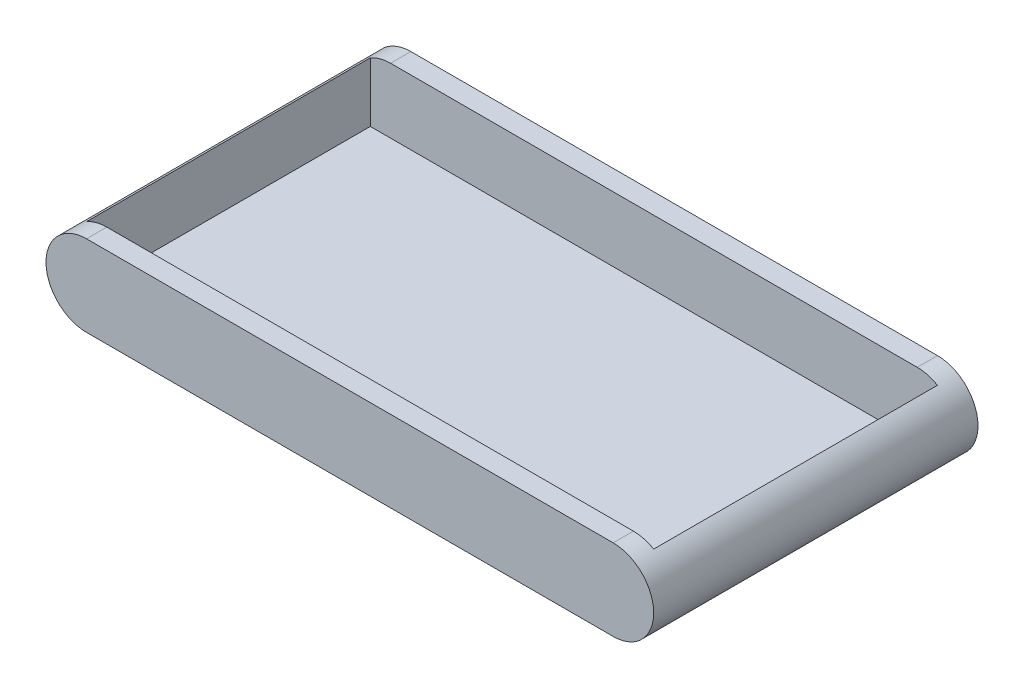
from build123d import *

# Parameters (mm, degrees)
BOSS_EXTRUDE1_DEPTH = 80
SKETCH2_W           = 139.903810567
SKETCH2_H           = 70
CUT_EXTRUDE1_DEPTH  = 16


with BuildPart() as part:
    # Sketch1 → Boss-Extrude1 (new body)
    with BuildSketch(Plane.XY):
        with BuildLine():
            Line((-3.900533574, 10.886474949), (126.003276993, 10.886474949))
            ThreePointArc((126.003276993, 10.886474949), (136.003276993, 0.886474949), (126.003276993, -9.113525051))
            Line((126.003276993, -9.113525051), (-3.900533574, -9.113525051))
            ThreePointArc((-3.900533574, -9.113525051), (-13.900533574, 0.886474949), (-3.900533574, 10.886474949))
        make_face()
    extrude(amount=-BOSS_EXTRUDE1_DEPTH)

    # Sketch2 → Cut-Extrude1 (cut)
    with BuildSketch(Plane(origin=(0, 10.886474949, 0), x_dir=(1, 0, 0), z_dir=(0, 1, 0))):
        with Locations((61.05137171, 40)):
            Rectangle(SKETCH2_W, SKETCH2_H)
    extrude(amount=-CUT_EXTRUDE1_DEPTH, mode=Mode.SUBTRACT)


solid = part.part
